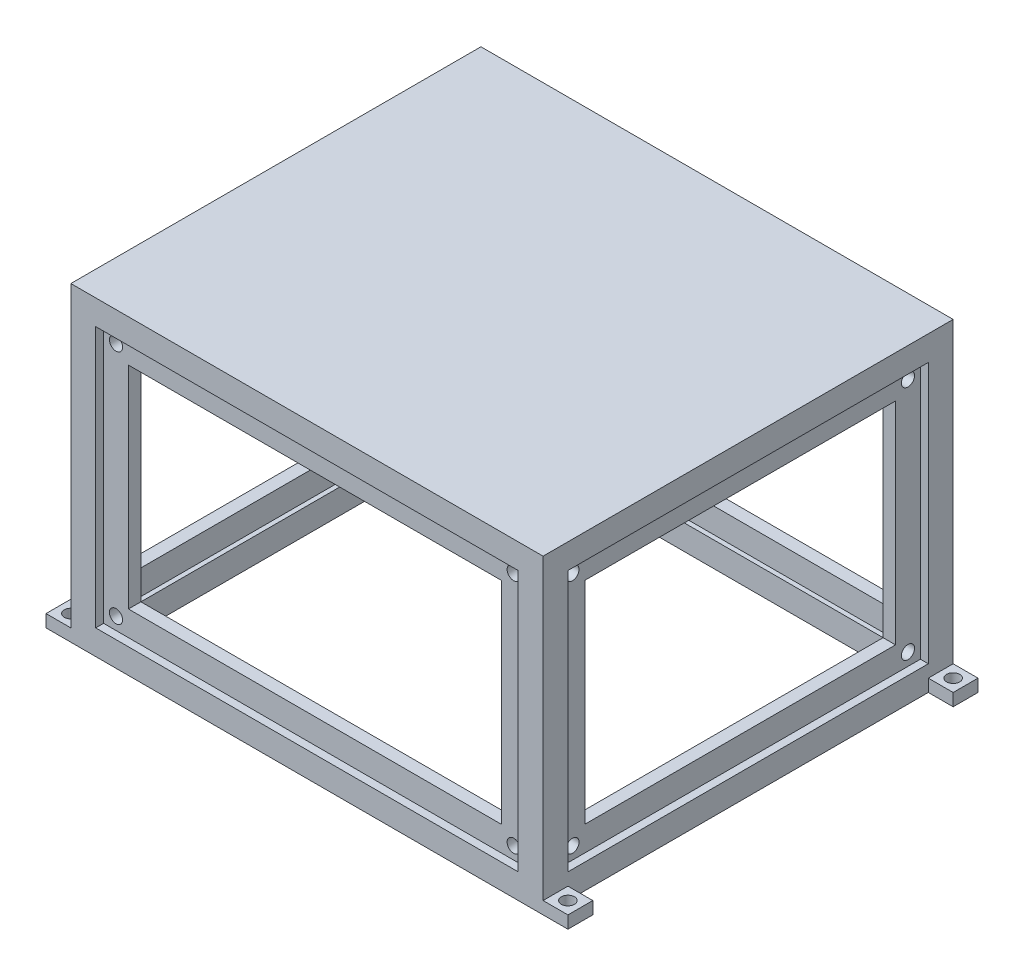
from build123d import *

# Parameters (mm, degrees)
SKETCH1_W               = 190
SKETCH1_H               = 165
BOSS_EXTRUDE1_DEPTH     = 125
SKETCH2_W               = 170
SKETCH2_H               = 145
CUT_EXTRUDE1_DEPTH      = 115
SKETCH3_W               = 10
SKETCH3_H               = 5
BOSS_EXTRUDE2_DEPTH     = 10
SKETCH4_W               = 170
SKETCH4_H               = 105
CUT_EXTRUDE2_DEPTH      = 10
BOSS_EXTRUDE3_START     = -3.175
SKETCH5_W               = 180
SKETCH5_H               = 115
SKETCH5_W_2             = 150
SKETCH5_H_2             = 85
BOSS_EXTRUDE3_DEPTH     = 5
SKETCH6_R               = 2.65
CUT_EXTRUDE3_DEPTH      = 5
SKETCH7_W               = 145
SKETCH7_H               = 105
CUT_EXTRUDE4_DEPTH      = 10
BOSS_EXTRUDE4_START     = -3.175
SKETCH8_W               = 155
SKETCH8_H               = 115
SKETCH8_W_2             = 125
SKETCH8_H_2             = 85
BOSS_EXTRUDE4_DEPTH     = 5
MIRROR3_COPY_1_SKETCH_W = 10
MIRROR3_COPY_1_SKETCH_H = 5
MIRROR3_COPY_1_DEPTH    = 10
MIRROR3_COPY_2_SKETCH_R = 2.65
MIRROR3_COPY_2_DEPTH    = 5
MIRROR3_COPY_3_SKETCH_W = 10
MIRROR3_COPY_3_SKETCH_H = 5
MIRROR3_COPY_3_DEPTH    = 10
MIRROR3_COPY_4_SKETCH_R = 2.65
MIRROR3_COPY_4_DEPTH    = 5
SKETCH9_R               = 2.65
CUT_EXTRUDE5_DEPTH      = 248.32838621
SKETCH10_R              = 2.65
CUT_EXTRUDE6_DEPTH      = 230.863721855


with BuildPart() as part:
    # Sketch1 → Boss-Extrude1 (new body)
    with BuildSketch(Plane(origin=(0, 0, 0), x_dir=(1, 0, 0), z_dir=(0, 1, 0))):
        Rectangle(SKETCH1_W, SKETCH1_H)
    extrude(amount=BOSS_EXTRUDE1_DEPTH)

    # Sketch2 → Cut-Extrude1 (cut)
    with BuildSketch(Plane.XZ):
        Rectangle(SKETCH2_W, SKETCH2_H)
    extrude(amount=-CUT_EXTRUDE1_DEPTH, mode=Mode.SUBTRACT)

    # Sketch3 → Boss-Extrude2 (add)
    with BuildSketch(Plane.ZY.offset(95)):
        with Locations((77.5, 2.5)):
            Rectangle(SKETCH3_W, SKETCH3_H)
    boss_extrude2 = extrude(amount=BOSS_EXTRUDE2_DEPTH)

    # Sketch4 → Cut-Extrude2 (cut)
    with BuildSketch(Plane.XY.offset(82.5)):
        with Locations((0, 62.5)):
            Rectangle(SKETCH4_W, SKETCH4_H)
    cut_extrude2 = extrude(amount=-CUT_EXTRUDE2_DEPTH, mode=Mode.SUBTRACT)

    # Sketch5 → Boss-Extrude3 (add)
    with BuildSketch(Plane.XY.offset(82.5).offset(BOSS_EXTRUDE3_START)):
        with Locations((0, 62.5)):
            Rectangle(SKETCH5_W, SKETCH5_H)
        with Locations((0, 62.5)):
            Rectangle(SKETCH5_W_2, SKETCH5_H_2, mode=Mode.SUBTRACT)
    boss_extrude3 = extrude(amount=-BOSS_EXTRUDE3_DEPTH)

    # Sketch6 → Cut-Extrude3 (cut)
    with BuildSketch(Plane(origin=(0, 5, 0), x_dir=(1, 0, 0), z_dir=(0, 1, 0))):
        with Locations((-100, -77.5)):
            Circle(SKETCH6_R)
    cut_extrude3 = extrude(amount=-CUT_EXTRUDE3_DEPTH, mode=Mode.SUBTRACT)

    # Mirror1: Cut-Extrude2, Boss-Extrude3 across plane
    add(cut_extrude2.mirror(Plane.XY), mode=Mode.SUBTRACT)
    add(boss_extrude3.mirror(Plane.XY))

    # Mirror2: Boss-Extrude2, Cut-Extrude3 across plane
    add(boss_extrude2.mirror(Plane.XY))
    add(cut_extrude3.mirror(Plane.XY), mode=Mode.SUBTRACT)

    # Sketch7 → Cut-Extrude4 (cut)
    with BuildSketch(Plane.ZY.offset(95)):
        with Locations((0, 62.5)):
            Rectangle(SKETCH7_W, SKETCH7_H)
    cut_extrude4 = extrude(amount=-CUT_EXTRUDE4_DEPTH, mode=Mode.SUBTRACT)

    # Sketch8 → Boss-Extrude4 (add)
    with BuildSketch(Plane.ZY.offset(95).offset(BOSS_EXTRUDE4_START)):
        with Locations((0, 62.5)):
            Rectangle(SKETCH8_W, SKETCH8_H)
        with Locations((0, 62.5)):
            Rectangle(SKETCH8_W_2, SKETCH8_H_2, mode=Mode.SUBTRACT)
    boss_extrude4 = extrude(amount=-BOSS_EXTRUDE4_DEPTH)

    # Mirror3: Cut-Extrude4, Boss-Extrude4 across plane
    add(cut_extrude4.mirror(Plane(origin=(0, 0, 0), x_dir=(0, 0, 1), z_dir=(1, 0, 0))), mode=Mode.SUBTRACT)
    add(boss_extrude4.mirror(Plane(origin=(0, 0, 0), x_dir=(0, 0, 1), z_dir=(1, 0, 0))))

    # Mirror3 copy 1 sketch → Mirror3 copy 1 (add)
    with BuildSketch(Plane(origin=(95, 0, 0), x_dir=(0, 0, -1), z_dir=(1, 0, 0))):
        with Locations((77.5, 2.5)):
            Rectangle(MIRROR3_COPY_1_SKETCH_W, MIRROR3_COPY_1_SKETCH_H)
    extrude(amount=MIRROR3_COPY_1_DEPTH)

    # Mirror3 copy 2 sketch → Mirror3 copy 2 (cut)
    with BuildSketch(Plane(origin=(0, 5, 0), x_dir=(-1, 0, 0), z_dir=(0, 1, 0))):
        with Locations((-100, -77.5)):
            Circle(MIRROR3_COPY_2_SKETCH_R)
    extrude(amount=-MIRROR3_COPY_2_DEPTH, mode=Mode.SUBTRACT)

    # Mirror3 copy 3 sketch → Mirror3 copy 3 (add)
    with BuildSketch(Plane(origin=(95, 0, 0), x_dir=(0, 0, 1), z_dir=(1, 0, 0))):
        with Locations((77.5, -2.5)):
            Rectangle(MIRROR3_COPY_3_SKETCH_W, MIRROR3_COPY_3_SKETCH_H)
    extrude(amount=MIRROR3_COPY_3_DEPTH)

    # Mirror3 copy 4 sketch → Mirror3 copy 4 (cut)
    with BuildSketch(Plane(origin=(0, 5, 0), x_dir=(-1, 0, 0), z_dir=(0, 1, 0))):
        with Locations((-100, 77.5)):
            Circle(MIRROR3_COPY_4_SKETCH_R)
    extrude(amount=-MIRROR3_COPY_4_DEPTH, mode=Mode.SUBTRACT)

    # Sketch9 → Cut-Extrude5 (cut, through all)
    with BuildSketch(Plane.ZY.offset(91.825)):
        with Locations((-67.5, 110)):
            Circle(SKETCH9_R)
        with Locations((-67.5, 15)):
            Circle(SKETCH9_R)
    cut_extrude5 = extrude(amount=-CUT_EXTRUDE5_DEPTH, mode=Mode.SUBTRACT)

    # Mirror4: Cut-Extrude5 across plane
    add(cut_extrude5.mirror(Plane.XY), mode=Mode.SUBTRACT)

    # Sketch10 → Cut-Extrude6 (cut, through all)
    with BuildSketch(Plane(origin=(0, 0, -79.325), x_dir=(-1, 0, 0), z_dir=(0, 0, -1))):
        with Locations((-80, 110)):
            Circle(SKETCH10_R)
        with Locations((-80, 15)):
            Circle(SKETCH10_R)
    cut_extrude6 = extrude(amount=-CUT_EXTRUDE6_DEPTH, mode=Mode.SUBTRACT)

    # Mirror5: Cut-Extrude6 across plane
    add(cut_extrude6.mirror(Plane(origin=(0, 0, 0), x_dir=(0, 0, 1), z_dir=(1, 0, 0))), mode=Mode.SUBTRACT)


solid = part.part
